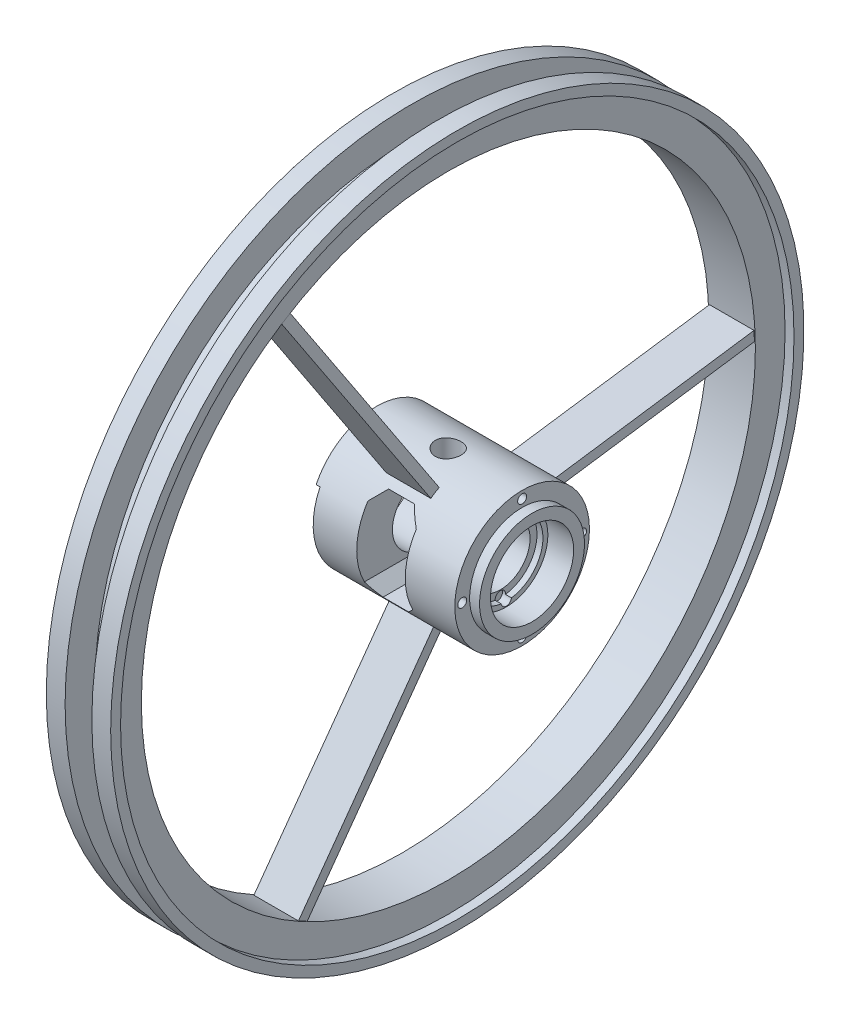
from build123d import *

# Parameters (mm, degrees)
SKETCH1_R                          = 68
BOSS_EXTRUDE1_DEPTH                = 157
CUT_EXTRUDE1_REACH                 = 186.111
SKETCH2_R                          = 26
SKETCH3_W                          = 136
SKETCH3_H                          = 98
CUT_EXTRUDE2_DEPTH                 = 4
CUT_EXTRUDE3_DEPTH                 = 44
SKETCH7_R                          = 42
CUT_EXTRUDE4_DEPTH                 = 26
SKETCH8_R                          = 37
CUT_EXTRUDE5_DEPTH                 = 6
SKETCH9_R                          = 30
CUT_EXTRUDE6_DEPTH                 = 30
CUT_EXTRUDE8_DEPTH                 = 71
TAP_DRILL_FOR_M1_2X0_25_TAP1_D     = 26
TAP_DRILL_FOR_M1_2X0_25_TAP1_DEPTH = 68
CUT_EXTRUDE9_START                 = -10
SKETCH27_R                         = 68
SKETCH27_R_2                       = 53
CUT_EXTRUDE9_DEPTH                 = 10
M8_CLEARANCE_HOLE1_D               = 9
M8_CLEARANCE_HOLE1_DEPTH           = 35
M8_CLEARANCE_HOLE1_TIP             = 2.703872786
BOSS_EXTRUDE4_DEPTH                = 5
CIRPATTERN4_COUNT                  = 3
M10_CLEARANCE_HOLE1_D              = 10.5
M10_CLEARANCE_HOLE1_DEPTH          = 9


with BuildPart() as part:
    # Sketch1 → Boss-Extrude1 (new body)
    with BuildSketch(Plane(origin=(0, 0, 0), x_dir=(0, 0, -1), z_dir=(1, 0, 0))):
        Circle(SKETCH1_R)
    extrude(amount=BOSS_EXTRUDE1_DEPTH)

    # Sketch2 → Cut-Extrude1 (cut, up to next)
    with BuildSketch(Plane.ZY, mode=Mode.PRIVATE) as cut_extrude1_sk1:
        Circle(SKETCH2_R)
    cut_extrude1_tool1 = extrude(cut_extrude1_sk1.sketch, amount=-CUT_EXTRUDE1_REACH, mode=Mode.PRIVATE) & part.part
    add(cut_extrude1_tool1.solids().sort_by_distance((0, 0, 0))[0], mode=Mode.SUBTRACT)

    # Sketch3 → Cut-Extrude2 (cut)
    with BuildSketch(Plane.ZY):
        with Locations((0, -19)):
            Rectangle(SKETCH3_W, SKETCH3_H)
    extrude(amount=-CUT_EXTRUDE2_DEPTH, mode=Mode.SUBTRACT)

    # Sketch4 → Cut-Extrude3 (cut)
    with BuildSketch(Plane.ZY.offset(-4)):
        with BuildLine():
            Line((-13.5, 29), (13.5, 29))
            ThreePointArc((13.5, 29), (0, -31.988279103), (-13.5, 29))
        make_face()
    extrude(amount=-CUT_EXTRUDE3_DEPTH, mode=Mode.SUBTRACT)

    # Sketch7 → Cut-Extrude4 (cut)
    with BuildSketch(Plane(origin=(157, 0, 0), x_dir=(0, 0, -1), z_dir=(1, 0, 0))):
        Circle(SKETCH7_R)
    extrude(amount=-CUT_EXTRUDE4_DEPTH, mode=Mode.SUBTRACT)

    # Sketch8 → Cut-Extrude5 (cut)
    with BuildSketch(Plane(origin=(131, 0, 0), x_dir=(0, 0, -1), z_dir=(1, 0, 0))):
        Circle(SKETCH8_R)
    extrude(amount=-CUT_EXTRUDE5_DEPTH, mode=Mode.SUBTRACT)

    # Sketch9 → Cut-Extrude6 (cut)
    with BuildSketch(Plane(origin=(125, 0, 0), x_dir=(0, 0, -1), z_dir=(1, 0, 0))):
        Circle(SKETCH9_R)
    extrude(amount=-CUT_EXTRUDE6_DEPTH, mode=Mode.SUBTRACT)

    # Sketch12 → Cut-Extrude8 (cut)
    with BuildSketch(Plane.XY.offset(68)):
        Polygon((48, 37.575966949), (48, -31.421583167), (59.373949205, -42.795532372), (85.373949205, -42.795532372), (97, -31.169481577), (97, 37.32386536), (85.373949205, 48.949916154), (59.373949205, 48.949916154), align=None)
    extrude(amount=-CUT_EXTRUDE8_DEPTH, mode=Mode.SUBTRACT)

    # Tap Drill for M1.2x0.25 Tap1
    with Locations(Plane(origin=(0, 68, 0), x_dir=(1, 0, 0), z_dir=(0, 1, 0))):
        with Locations((72.373949205, 0)):
            Hole(TAP_DRILL_FOR_M1_2X0_25_TAP1_D / 2, depth=TAP_DRILL_FOR_M1_2X0_25_TAP1_DEPTH)

    # Sketch27 → Cut-Extrude9 (cut)
    with BuildSketch(Plane(origin=(157, 0, 0), x_dir=(0, 0, -1), z_dir=(1, 0, 0)).offset(CUT_EXTRUDE9_START)):
        Circle(SKETCH27_R)
        Circle(SKETCH27_R_2, mode=Mode.SUBTRACT)
    extrude(amount=CUT_EXTRUDE9_DEPTH, mode=Mode.SUBTRACT)

    # M8 Clearance Hole1
    with Locations(Plane(origin=(147, 0, 0), x_dir=(0, 0, -1), z_dir=(1, 0, 0))):
        with Locations((-60.5, 0), (0, 60.5), (60.5, 0), (0, -60.5)):
            Hole(M8_CLEARANCE_HOLE1_D / 2, depth=M8_CLEARANCE_HOLE1_DEPTH)
            with Locations((0, 0, -(M8_CLEARANCE_HOLE1_DEPTH + M8_CLEARANCE_HOLE1_TIP / 2))):  # 118° drill point
                Cone(0, M8_CLEARANCE_HOLE1_D / 2, M8_CLEARANCE_HOLE1_TIP, mode=Mode.SUBTRACT)



with BuildPart() as body_2:
    # Sketch21 → Revolve1 (revolve)
    with BuildSketch(Plane(origin=(0, 0, 0), x_dir=(-1, 0, 0), z_dir=(0, 0.528534662230602, -0.8489117214532872))):
        Polygon((-71.519474344, 310), (-72.519474344, 310), (-72.519474344, 340), (-81.519474344, 340), (-81.519474344, 350), (-62.519474344, 350), (-62.519474344, 320), (-35.519474344, 320), (-35.519474344, 350), (-16.519474344, 350), (-16.519474344, 340), (-25.519474344, 340), (-25.519474344, 310), (-26.519474344, 310), align=None)
    revolve(axis=Axis((0, 0, 0), (1, 0, 0)))


with BuildPart() as part_1:
    add(part.part)

    add(body_2.part)  # Boss-Extrude4 merges body 2
    # Sketch19 → Boss-Extrude4 (add, symmetric)
    with BuildSketch(Plane(origin=(0, 0, 0), x_dir=(-1, 0, 0), z_dir=(0, 0.528534662230602, -0.8489117214532872))):
        Polygon((-26.519474344, 310), (-71.519474344, 310), (-95, 66.5), (-50, 66.5), align=None)
    boss_extrude4 = extrude(amount=BOSS_EXTRUDE4_DEPTH, both=True)

    # CirPattern4: Boss-Extrude4 ×3 about axis
    cirpattern4_axis = Axis((0, 0, 0), (1, 0, 0))
    for i in range(1, CIRPATTERN4_COUNT):
        add(boss_extrude4.rotate(cirpattern4_axis, i * 360 / CIRPATTERN4_COUNT))

    # M10 Clearance Hole1
    with Locations(Plane(origin=(131, 0, 0), x_dir=(0, 0, -1), z_dir=(1, 0, 0))):
        with Locations((0, -36)):
            Hole(M10_CLEARANCE_HOLE1_D / 2, depth=M10_CLEARANCE_HOLE1_DEPTH)


solid = part_1.part
